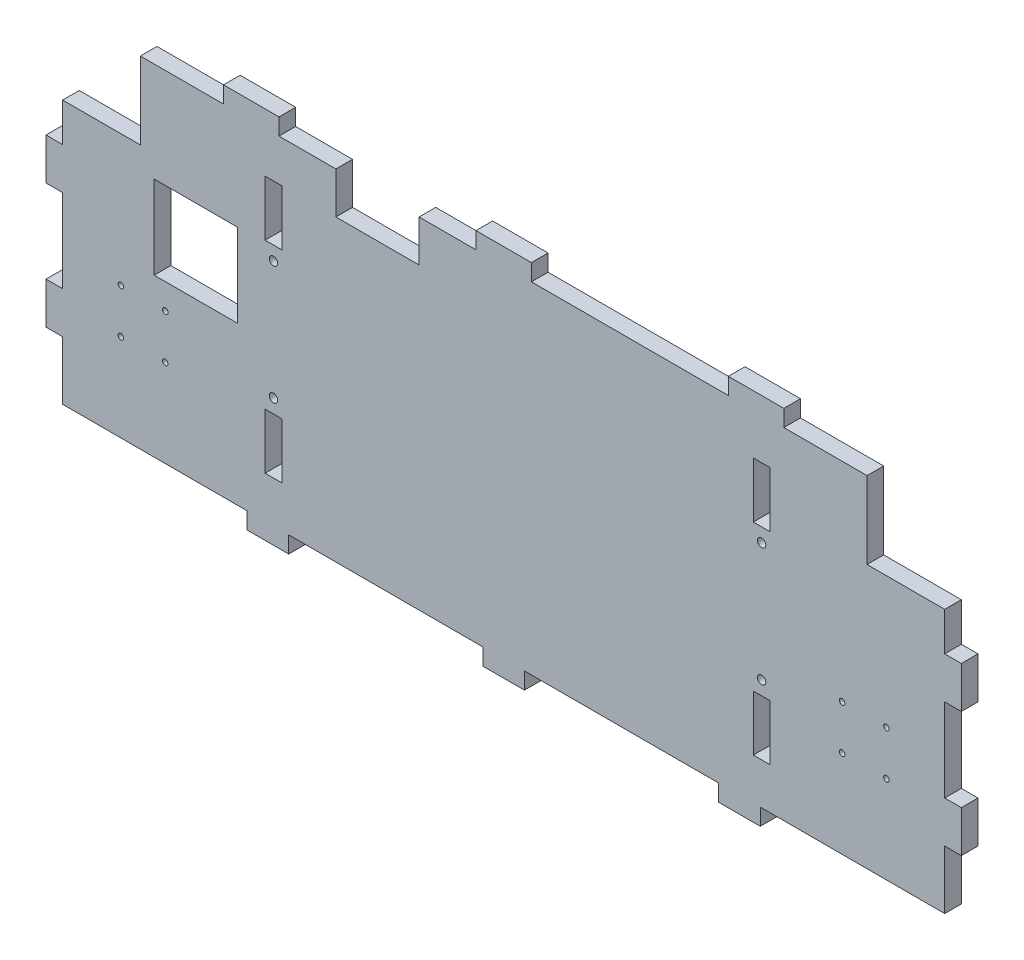
from build123d import *

# Parameters (mm, degrees)
ESQUISSE1_W             = 6
ESQUISSE1_H             = 20
ESQUISSE1_W_2           = 30
ESQUISSE1_H_2           = 30
BOSS_EXTRU_1_DEPTH      = 6
ESQUISSE2_W             = 15
ESQUISSE2_H             = 6
ESQUISSE2_W_2           = 6
ESQUISSE2_H_2           = 15
ESQUISSE2_W_3           = 20
BOSS_EXTRU_2_DEPTH      = 6
ESQUISSE3_R             = 1
ESQUISSE3_R_2           = 1.5
ENL_V_MAT_EXTRU_1_DEPTH = 6
ESQUISSE4_W             = 30
ESQUISSE4_H             = 15
ENL_V_MAT_EXTRU_2_DEPTH = 6


with BuildPart() as part:
    # Esquisse1 → Boss.-Extru.1 (new body)
    with BuildSketch(Plane.XY):
        Polygon((-159, 35), (-131, 35), (-131, 62.75), (131, 62.75), (131, 35), (159, 35), (159, -60), (-159, -60), align=None)
        with Locations((93, 37.75)):
            Rectangle(ESQUISSE1_W, ESQUISSE1_H, mode=Mode.SUBTRACT)
        with Locations((93, -35.01)):
            Rectangle(ESQUISSE1_W, ESQUISSE1_H, mode=Mode.SUBTRACT)
        with Locations((-83, 37.75)):
            Rectangle(ESQUISSE1_W, ESQUISSE1_H, mode=Mode.SUBTRACT)
        with Locations((-83, -35.01)):
            Rectangle(ESQUISSE1_W, ESQUISSE1_H, mode=Mode.SUBTRACT)
        with Locations((-110.986534361, 11.825583908)):
            Rectangle(ESQUISSE1_W_2, ESQUISSE1_H_2, mode=Mode.SUBTRACT)
    extrude(amount=BOSS_EXTRU_1_DEPTH)

    # Esquisse2 → Boss.-Extru.2 (add)
    with BuildSketch(Plane.XY.offset(6)):
        with Locations((-85, -63)):
            Rectangle(ESQUISSE2_W, ESQUISSE2_H)
        with Locations((0, -63)):
            Rectangle(ESQUISSE2_W, ESQUISSE2_H)
        with Locations((85, -63)):
            Rectangle(ESQUISSE2_W, ESQUISSE2_H)
        with Locations((-162, 13.59)):
            Rectangle(ESQUISSE2_W_2, ESQUISSE2_H_2)
        with Locations((-162, -31.41)):
            Rectangle(ESQUISSE2_W_2, ESQUISSE2_H_2)
        with Locations((162, -31.41)):
            Rectangle(ESQUISSE2_W_2, ESQUISSE2_H_2)
        with Locations((162, 13.59)):
            Rectangle(ESQUISSE2_W_2, ESQUISSE2_H_2)
        with Locations((91, 65.75)):
            Rectangle(ESQUISSE2_W_3, ESQUISSE2_H)
        with Locations((-91, 65.75)):
            Rectangle(ESQUISSE2_W_3, ESQUISSE2_H)
        with Locations((0, 65.75)):
            Rectangle(ESQUISSE2_W_3, ESQUISSE2_H)
    extrude(amount=-BOSS_EXTRU_2_DEPTH)

    # Esquisse3 → Enlèv. mat.-Extru.1 (cut)
    with BuildSketch(Plane(origin=(0, 0, 0), x_dir=(-1, 0, 0), z_dir=(0, 0, -1))):
        with Locations((138, -28.38)):
            Circle(ESQUISSE3_R)
        with Locations((138, -12.38)):
            Circle(ESQUISSE3_R)
        with Locations((122, -12.38)):
            Circle(ESQUISSE3_R)
        with Locations((122, -28.38)):
            Circle(ESQUISSE3_R)
        with Locations((-122, -28.38)):
            Circle(ESQUISSE3_R)
        with Locations((-122, -12.38)):
            Circle(ESQUISSE3_R)
        with Locations((-138, -12.38)):
            Circle(ESQUISSE3_R)
        with Locations((-138, -28.38)):
            Circle(ESQUISSE3_R)
        with Locations((83, 22.75)):
            Circle(ESQUISSE3_R_2)
        with Locations((83, -20.01)):
            Circle(ESQUISSE3_R_2)
        with Locations((-93, 22.75)):
            Circle(ESQUISSE3_R_2)
        with Locations((-93, -20.01)):
            Circle(ESQUISSE3_R_2)
    extrude(amount=-ENL_V_MAT_EXTRU_1_DEPTH, mode=Mode.SUBTRACT)

    # Esquisse4 → Enlèv. mat.-Extru.2 (cut)
    with BuildSketch(Plane(origin=(0, 0, 0), x_dir=(-1, 0, 0), z_dir=(0, 0, -1))):
        with Locations((45.5, 55.25)):
            Rectangle(ESQUISSE4_W, ESQUISSE4_H)
    extrude(amount=-ENL_V_MAT_EXTRU_2_DEPTH, mode=Mode.SUBTRACT)


solid = part.part
